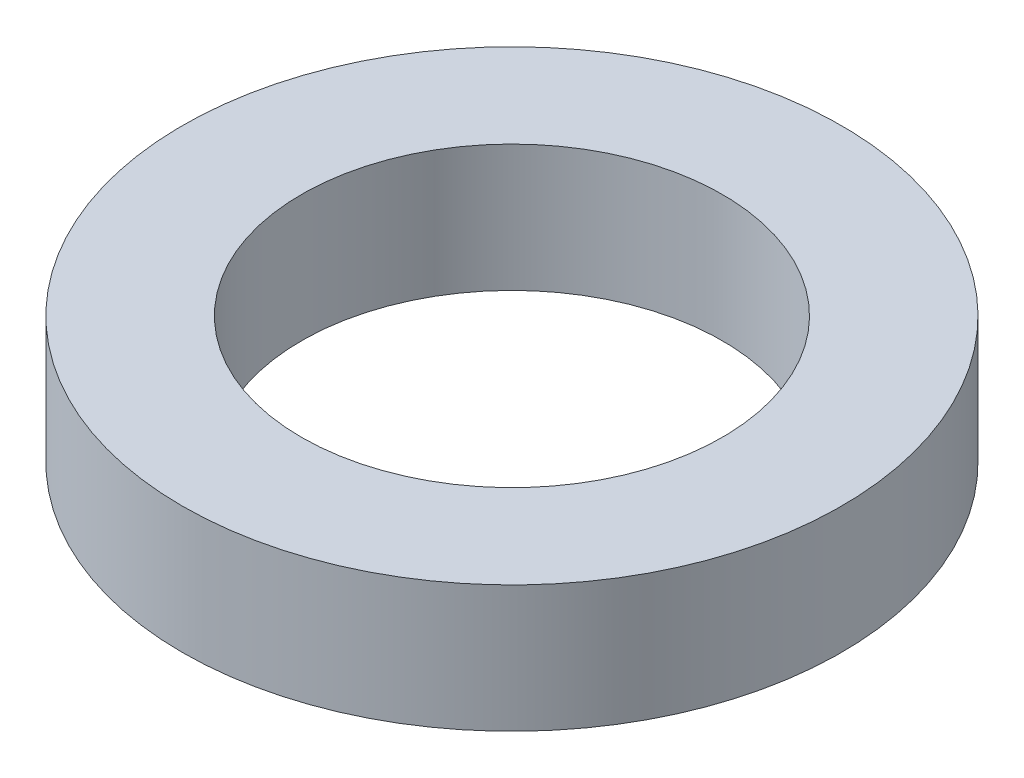
from build123d import *

# Parameters (mm, degrees)
SKETCH1_W = 2.35
SKETCH1_H = 2.5


with BuildPart() as part:
    # Sketch1 → Revolve1 (revolve)
    with BuildSketch(Plane.XY):
        with Locations((-5.325, 1.25)):
            Rectangle(SKETCH1_W, SKETCH1_H)
    revolve(axis=Axis((0, 0, 0), (0, -1, 0)))


solid = part.part
